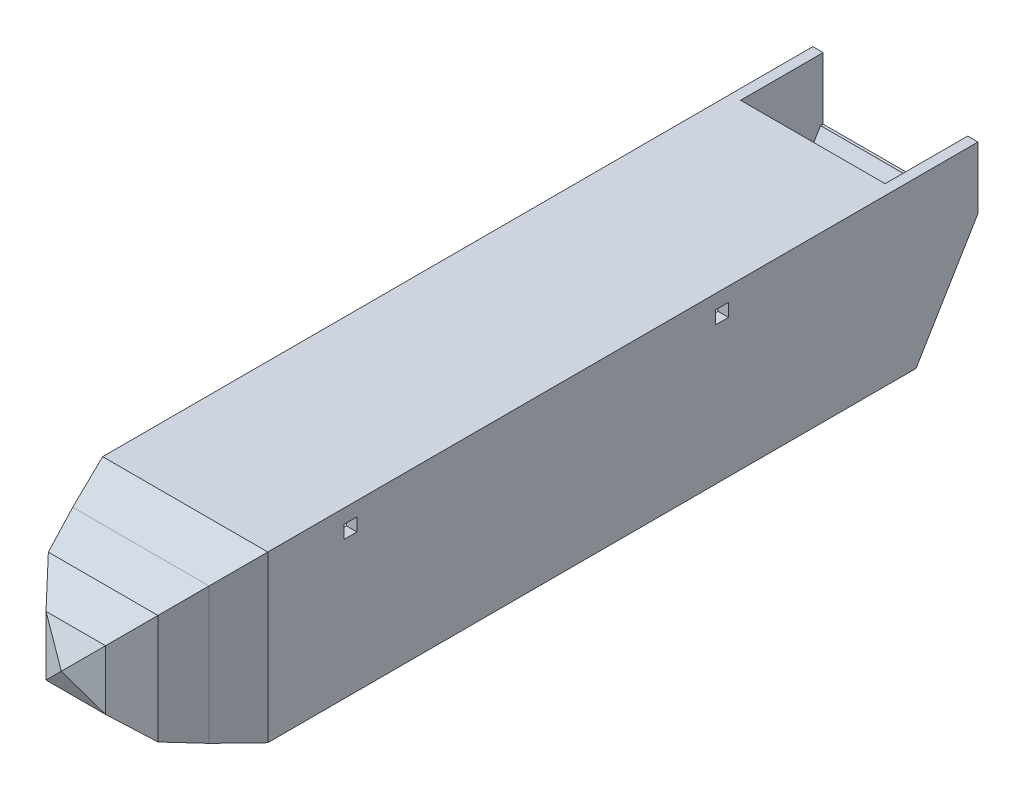
from build123d import *

# Parameters (mm, degrees)
SKETCH1_W           = 101.6
SKETCH1_H           = 101.6
BOSS_EXTRUDE1_DEPTH = 436.88
SHELL1_T            = -6.35
SKETCH9_W           = 8.001
SKETCH9_H           = 8.001
CUT_EXTRUDE1_DEPTH  = 526.503840631
CUT_EXTRUDE2_DEPTH  = 526.503840631
BOSS_EXTRUDE2_DEPTH = 101.6
SKETCH12_W          = 88.9
SKETCH12_H          = 38.1
CUT_EXTRUDE3_DEPTH  = 50.8


with BuildPart() as part:
    # Sketch1 → Boss-Extrude1 (new body)
    with BuildSketch(Plane.XY):
        Rectangle(SKETCH1_W, SKETCH1_H)
    extrude(amount=BOSS_EXTRUDE1_DEPTH)

    # Sketch5 → Loft2 section 0
    with BuildSketch(Plane.XY.offset(436.88)):
        with BuildLine():
            Line((50.8, -50.8), (50.8, 50.8))
            Line((50.8, 50.8), (-50.8, 50.8))
            Line((-50.8, 50.8), (-50.8, -50.8))
            Line((-50.8, -50.8), (50.8, -50.8))
        make_face()
    # Sketch3 → Loft2 section 1
    with BuildSketch(Plane.XY.offset(464.156588322)):
        with BuildLine():
            Line((-41.937305, -41.937305), (41.937305, -41.937305))
            Line((41.937305, -41.937305), (41.937305, 41.937305))
            Line((41.937305, 41.937305), (-41.937305, 41.937305))
            Line((-41.937305, 41.937305), (-41.937305, -41.937305))
        make_face()
    loft()

    # Sketch3<6> → Loft3 section 0
    with BuildSketch(Plane.XY.offset(464.156588322)):
        with BuildLine():
            Line((-41.937305, -41.937305), (41.937305, -41.937305))
            Line((41.937305, -41.937305), (41.937305, 41.937305))
            Line((41.937305, 41.937305), (-41.937305, 41.937305))
            Line((-41.937305, 41.937305), (-41.937305, -41.937305))
        make_face()
    # Sketch6 → Loft3 section 1
    with BuildSketch(Plane.XY.offset(487.359440316)):
        with BuildLine():
            Line((-33.71596, -33.71596), (33.71596, -33.71596))
            Line((33.71596, -33.71596), (33.71596, 33.71596))
            Line((33.71596, 33.71596), (-33.71596, 33.71596))
            Line((-33.71596, 33.71596), (-33.71596, -33.71596))
        make_face()
    loft()

    # Sketch6<4> → Loft4 section 0
    with BuildSketch(Plane.XY.offset(487.359440316)):
        with BuildLine():
            Line((-33.71596, -33.71596), (33.71596, -33.71596))
            Line((33.71596, -33.71596), (33.71596, 33.71596))
            Line((33.71596, 33.71596), (-33.71596, 33.71596))
            Line((-33.71596, 33.71596), (-33.71596, -33.71596))
        make_face()
    # Sketch7 → Loft4 section 1
    with BuildSketch(Plane.XY.offset(504.217299158)):
        with BuildLine():
            Line((-18.304143458, -18.304143458), (18.304143458, -18.304143458))
            Line((18.304143458, -18.304143458), (18.304143458, 18.304143458))
            Line((18.304143458, 18.304143458), (-18.304143458, 18.304143458))
            Line((-18.304143458, 18.304143458), (-18.304143458, -18.304143458))
        make_face()
    loft()

    # Sketch7<5> → Loft5 section 0
    with BuildSketch(Plane.XY.offset(504.217299158), mode=Mode.PRIVATE) as loft5_s0:
        with BuildLine():
            Line((-18.304143458, -18.304143458), (18.304143458, -18.304143458))
            Line((18.304143458, -18.304143458), (18.304143458, 18.304143458))
            Line((18.304143458, 18.304143458), (-18.304143458, 18.304143458))
            Line((-18.304143458, 18.304143458), (-18.304143458, -18.304143458))
        make_face()
    loft([Vertex(0, 0, 513.079999985), loft5_s0.sketch])

    # Shell1
    shell1_openings = [part.faces().sort_by_distance(p)[0] for p in [
        (0, 0, 0),
    ]]
    offset(amount=SHELL1_T, openings=shell1_openings, kind=Kind.INTERSECTION)

    # Sketch9 → Cut-Extrude1 (cut, through all)
    with BuildSketch(Plane(origin=(50.8, 0, 0), x_dir=(0, 0, -1), z_dir=(1, 0, 0))):
        with Locations((-386.08, 38.1)):
            Rectangle(SKETCH9_W, SKETCH9_H)
        Polygon((-161.4805, 42.1005), (-161.4805, 38.1), (-161.4805, 34.0995), (-153.4795, 34.0995), (-153.4795, 42.1005), align=None)
    extrude(amount=-CUT_EXTRUDE1_DEPTH, mode=Mode.SUBTRACT)

    # Sketch10 → Cut-Extrude2 (cut, through all)
    with BuildSketch(Plane(origin=(50.8, 0, 0), x_dir=(0, 0, -1), z_dir=(1, 0, 0))):
        Polygon((0, -50.8), (0, 12.7), (-38.1, -50.8), align=None)
    extrude(amount=-CUT_EXTRUDE2_DEPTH, mode=Mode.SUBTRACT)

    # Sketch11 → Boss-Extrude2 (add)
    with BuildSketch(Plane(origin=(50.8, 0, 0), x_dir=(0, 0, -1), z_dir=(1, 0, 0))):
        Polygon((-38.1, -50.8), (-39.6875, -50.8), (-1.5875, 12.7), (-1.5875, 50.8), (0, 50.8), (0, 12.7), align=None)
    extrude(amount=-BOSS_EXTRUDE2_DEPTH)

    # Sketch12 → Cut-Extrude3 (cut)
    with BuildSketch(Plane(origin=(0, 0, 0), x_dir=(-1, 0, 0), z_dir=(0, 0, -1))):
        with Locations((0, 31.75)):
            Rectangle(SKETCH12_W, SKETCH12_H)
    extrude(amount=-CUT_EXTRUDE3_DEPTH, mode=Mode.SUBTRACT)


solid = part.part
